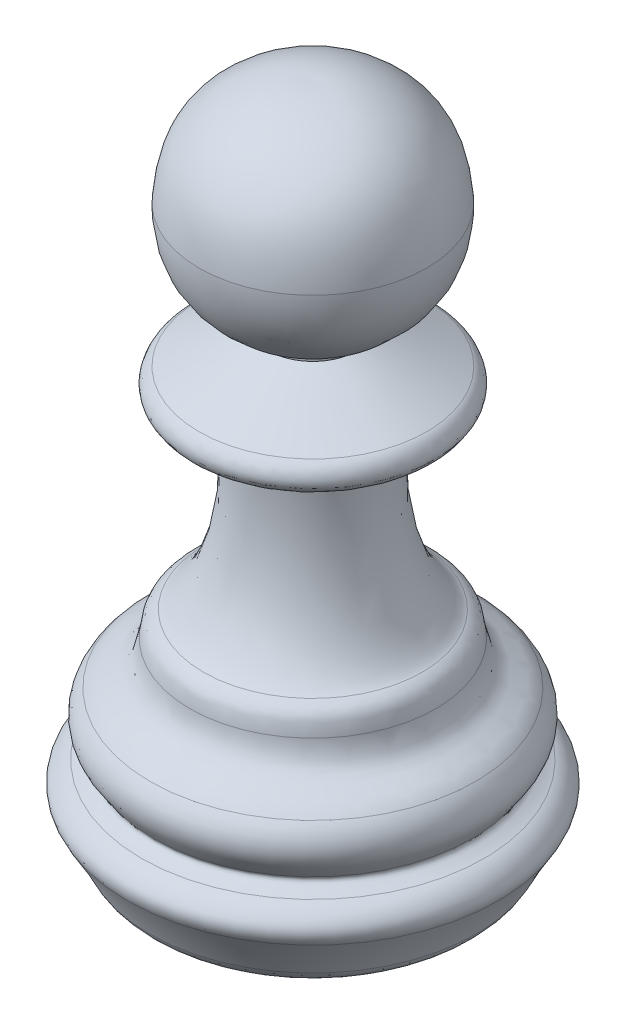
from build123d import *

# Parameters (mm, degrees)
FILLET2_R = 15


with BuildPart() as part:
    # Sketch1 → Revolve2 (revolve)
    with BuildSketch(Plane.XY):
        with BuildLine():
            Line((0, 26.625071466), (0, 0))
            Line((0, 0), (5.543805409, 0))
            add(Edge.make_bspline(
                [(6.319793296, 1.525847677), (6.889302205, 0.686287118), (5.543805409, 0)],
                knots=[0, 0, 0, 1, 1, 1], degree=2))
            add(Edge.make_bspline(
                [(7.085307754, 2.055592338), (6.864738604, 1.829988787), (6.609567118, 1.653407233), (6.319793296, 1.525847677)],
                knots=[0, 0, 0, 0, 1, 1, 1, 1], degree=3))
            add(Edge.make_bspline(
                [(6.741362661, 3.478452892), (6.970710589, 3.391049286), (7.40122549, 3.03910509), (7.53941056, 2.520059856), (7.085307754, 2.055592338)],
                knots=[0, 0, 0, 0, 0.372722308, 1, 1, 1, 1], degree=3))
            add(Edge.make_bspline(
                [(6.247749325, 3.897860565), (6.218723376, 3.855258339), (6.183941334, 3.717754673), (6.445100579, 3.573341428), (6.690034137, 3.498013993), (6.741362661, 3.478452892)],
                knots=[0, 0, 0, 0, 0.162366513, 0.584346053, 1, 1, 1, 1], degree=3))
            add(Edge.make_bspline(
                [(6.402401794, 5.930190735), (6.784177677, 5.531343902), (6.951661459, 4.728187202), (6.426334589, 4.159975336), (6.247749325, 3.897860565)],
                knots=[0, 0, 0, 0, 0.588501572, 1, 1, 1, 1], degree=3))
            add(Edge.make_bspline(
                [(4.833967561, 7.625249343), (4.874718363, 7.30367232), (5.109048802, 6.449189117), (6.007021611, 6.343250178), (6.402401794, 5.930190735)],
                knots=[0, 0, 0, 0, 0.377644998, 1, 1, 1, 1], degree=3))
            add(Edge.make_bspline(
                [(4.301931531, 8.604902513), (4.459652634, 8.524803103), (4.778738537, 8.275930853), (4.799900285, 7.894084624), (4.833967561, 7.625249343)],
                knots=[0, 0, 0, 0, 0.408405695, 1, 1, 1, 1], degree=3))
            add(Edge.make_bspline(
                [(2.735852942, 15.689695119), (2.13635684, 11.136275765), (3.716131859, 8.902403651), (4.301931531, 8.604902513)],
                knots=[0, 0, 0, 0, 1, 1, 1, 1], degree=3))
            Line((2.735852942, 15.689695119), (4.146774256, 15.689695119))
            add(Edge.make_bspline(
                [(4.479001376, 16.888442397), (4.679498126, 16.786031007), (5.067202986, 16.164049956), (4.493493746, 15.689695119), (4.146774256, 15.689695119)],
                knots=[0, 0, 0, 0, 0.447467442, 1, 1, 1, 1], degree=3))
            Line((4.479001376, 16.888442397), (1.748997287, 18.282896499))
            Line((1.748997287, 18.282896499), (1.748997287, 18.519100682))
            add(Edge.make_bspline(
                [(4.479001376, 22.465552786), (4.493335744, 19.724714624), (1.748997287, 18.519100682)],
                knots=[0, 0, 0, 1, 1, 1], degree=2))
            add(Edge.make_bspline(
                [(0, 26.625071466), (1.261982799, 26.720448123), (3.78083459, 25.70244409), (4.410562491, 23.567274656), (4.479001376, 22.465552786)],
                knots=[0, 0, 0, 0, 0.57860408, 1, 1, 1, 1], degree=3))
        make_face()
    revolve(axis=Axis((0, 26.625071466, 0), (0, -1, 0)))

    # Fillet2
    fillet2_edges = [part.edges().sort_by_distance(p)[0] for p in [
        (-6.319793296, 1.525847677, 0),
    ]]
    fillet(fillet2_edges, radius=FILLET2_R)


solid = part.part
